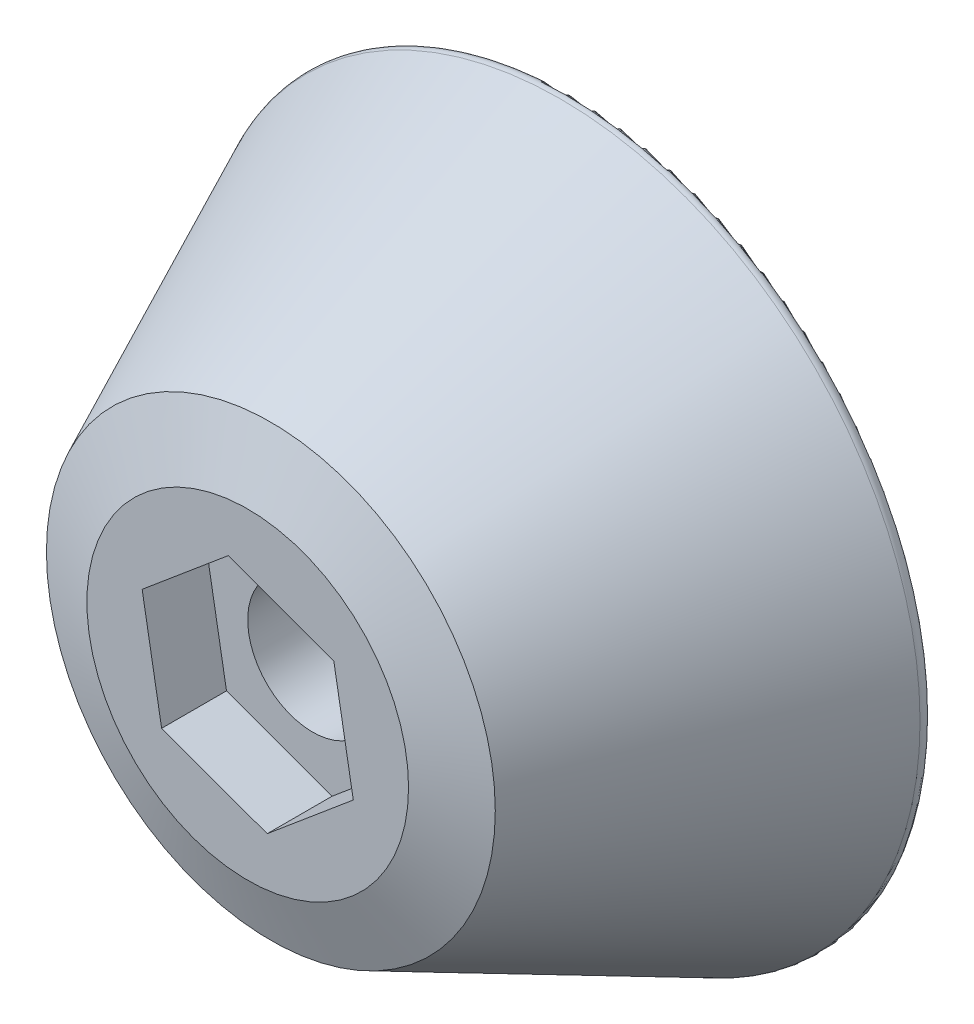
from build123d import *

# Parameters (mm, degrees)
SKETCH1_R          = 28.575
CONE_EXTRUDE_DEPTH = 25.4
CONE_EXTRUDE_TAPER = 25
CHAMFER1_SIZE      = 2
CHAMFER1_SIZE_2    = 4.134883836
NUT_HOLE_CUT_DEPTH = 5.08
SKETCH4_R          = 5.08
CUT_EXTRUDE2_DEPTH = 46.232329699
FILLET2_R          = 0.635


with BuildPart() as part:
    # Sketch1 → Cone Extrude (new body)
    with BuildSketch(Plane.XY):
        Circle(SKETCH1_R)
    extrude(amount=CONE_EXTRUDE_DEPTH, taper=CONE_EXTRUDE_TAPER)

    # Chamfer1
    # the kernel refuses this chamfer: 4.134883836, 2 mm, written as the material it takes off along each edge
    with BuildSketch(Plane(origin=(0, 0, 25.4), x_dir=(1, 0, 0), z_dir=(0, 1, 0))) as chamfer1_piece_1:
        Polygon((16.730785483 + CHAMFER1_SIZE * 0.422618261741, CHAMFER1_SIZE * 0.906307787037), (16.730785483 - CHAMFER1_SIZE_2, 0), (16.730785483, 0), align=None)
    revolve(axis=Axis((0, 0, 25.4), (0, 0, -1)), mode=Mode.SUBTRACT)

    # Sketch3 → Nut Hole Cut (cut)
    with BuildSketch(Plane.XY.offset(25.4)):
        Polygon((6.741570116, 5.654240212), (-1.525930605, 8.665491088), (-8.267500721, 3.011250876), (-6.741570116, -5.654240212), (1.525930605, -8.665491088), (8.267500721, -3.011250876), align=None)
    extrude(amount=-NUT_HOLE_CUT_DEPTH, mode=Mode.SUBTRACT)

    # Sketch4 → Cut-Extrude2 (cut, through all)
    with BuildSketch(Plane.XY.offset(20.32)):
        Circle(SKETCH4_R)
    extrude(amount=-CUT_EXTRUDE2_DEPTH, mode=Mode.SUBTRACT)

    # Fillet2
    fillet2_edges = [part.edges().sort_by_distance(p)[0] for p in [
        (-28.575, 0, 0),
    ]]
    fillet(fillet2_edges, radius=FILLET2_R)


solid = part.part
